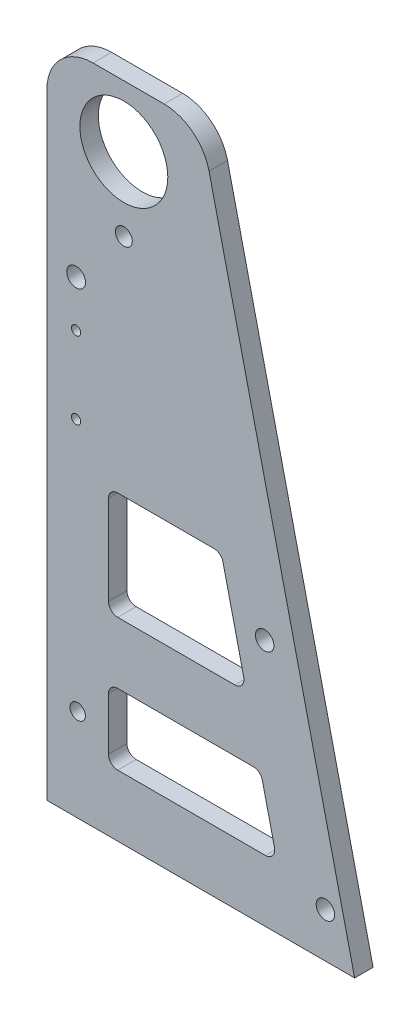
from build123d import *

# Parameters (mm, degrees)
ESBO_O1_R                = 14.2875
ESBO_O1_R_2              = 2.5
RESSALTO_EXTRUS_O2_DEPTH = 6
FILETE1_R                = 15
ESBO_O3_R                = 1.5
ESBO_O3_R_2              = 3
ESBO_O3_R_3              = 3.05
CORTE_EXTRUS_O1_DEPTH    = 238.194013415
ESBO_O5_R                = 2.75
ESBO_O5_R_2              = 3
CORTE_EXTRUS_O2_DEPTH    = 238.194013415


with BuildPart() as part:
    # Esboço1 → Ressalto-extrusão2 (new body)
    with BuildSketch(Plane.XY):
        Polygon((0, 0), (0, 215), (50, 215), (100, 0), align=None)
        with Locations((25, 195)):
            Circle(ESBO_O1_R, mode=Mode.SUBTRACT)
        with Locations((10, 30)):
            Circle(ESBO_O1_R_2, mode=Mode.SUBTRACT)
        with BuildLine():
            Line((20, 95), (20, 66))
            ThreePointArc((20, 66), (20.878679656, 63.878679656), (23, 63))
            Line((23, 63), (61.03739436, 63))
            ThreePointArc((61.03739436, 63), (63.386715693, 64.134339454), (63.959418441, 66.679540484))
            Line((63.959418441, 66.679540484), (57.215232395, 95.679540484))
            ThreePointArc((57.215232395, 95.679540484), (56.15886886, 97.349321333), (54.293208314, 98))
            Line((54.293208314, 98), (23, 98))
            ThreePointArc((23, 98), (20.878679656, 97.121320344), (20, 95))
        make_face(mode=Mode.SUBTRACT)
        with BuildLine():
            Line((20, 40), (20, 23))
            ThreePointArc((20, 23), (20.878679656, 20.878679656), (23, 20))
            Line((23, 20), (71.03739436, 20))
            ThreePointArc((71.03739436, 20), (73.386715693, 21.134339454), (73.959418441, 23.679540484))
            Line((73.959418441, 23.679540484), (70.005930069, 40.679540484))
            ThreePointArc((70.005930069, 40.679540484), (68.949566534, 42.349321333), (67.083905988, 43))
            Line((67.083905988, 43), (23, 43))
            ThreePointArc((23, 43), (20.878679656, 42.121320344), (20, 40))
        make_face(mode=Mode.SUBTRACT)
    extrude(amount=RESSALTO_EXTRUS_O2_DEPTH)

    # Filete1
    filete1_edges = [part.edges().sort_by_distance(p)[0] for p in [
        (0, 215, 3),
        (50, 215, 3),
    ]]
    fillet(filete1_edges, radius=FILETE1_R)

    # Esboço3 → Corte-extrusão1 (cut, through all)
    with BuildSketch(Plane(origin=(0, 0, 0), x_dir=(-1, 0, 0), z_dir=(0, 0, -1))):
        with Locations((-9.5, 112)):
            Circle(ESBO_O3_R)
        with Locations((-90.5, 14.5)):
            Circle(ESBO_O3_R_2)
        with Locations((-9.5, 137)):
            Circle(ESBO_O3_R)
        with Locations((-9.5, 152)):
            Circle(ESBO_O3_R_3)
    extrude(amount=-CORTE_EXTRUS_O1_DEPTH, mode=Mode.SUBTRACT)

    # Esboço5 → Corte-extrusão2 (cut, through all)
    with BuildSketch(Plane(origin=(0, 0, 0), x_dir=(-1, 0, 0), z_dir=(0, 0, -1))):
        with Locations((-25, 171.1875)):
            Circle(ESBO_O5_R)
        with Locations((-70.759810426, 80.398555206)):
            Circle(ESBO_O5_R_2)
    extrude(amount=-CORTE_EXTRUS_O2_DEPTH, mode=Mode.SUBTRACT)


solid = part.part
